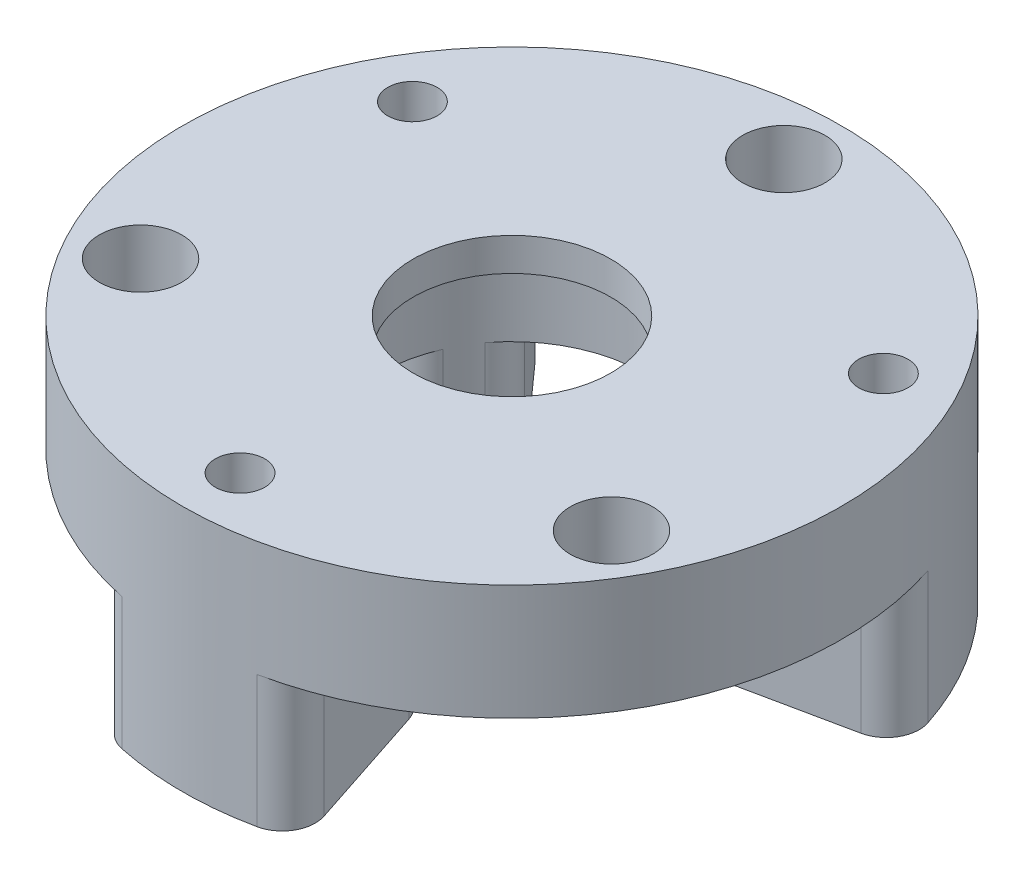
from build123d import *

# Parameters (mm, degrees)
SKETCH1_R           = 20
SKETCH1_R_2         = 8
BOSS_EXTRUDE1_DEPTH = 8
SKETCH2_R           = 20
SKETCH2_R_2         = 8
BOSS_EXTRUDE2_DEPTH = 7
BOSS_EXTRUDE3_START = -2
SKETCH3_R           = 8
SKETCH3_R_2         = 6
BOSS_EXTRUDE3_DEPTH = 2
SKETCH4_R           = 2.5
SKETCH4_R_2         = 1.5
CUT_EXTRUDE1_DEPTH  = 33.015621187
SKETCH5_R           = 2.5
CUT_EXTRUDE2_DEPTH  = 8
CIRPATTERN1_COUNT   = 3
FILLET1_R           = 2


with BuildPart() as part:
    # Sketch1 → Boss-Extrude1 (new body)
    with BuildSketch(Plane(origin=(0, 0, 0), x_dir=(1, 0, 0), z_dir=(0, 1, 0))):
        Circle(SKETCH1_R)
        Circle(SKETCH1_R_2, mode=Mode.SUBTRACT)
    extrude(amount=BOSS_EXTRUDE1_DEPTH)

    # Sketch2 → Boss-Extrude2 (add)
    with BuildSketch(Plane(origin=(0, 8, 0), x_dir=(1, 0, 0), z_dir=(0, 1, 0))):
        Circle(SKETCH2_R)
        Circle(SKETCH2_R_2, mode=Mode.SUBTRACT)
    extrude(amount=BOSS_EXTRUDE2_DEPTH)

    # Sketch3 → Boss-Extrude3 (add)
    with BuildSketch(Plane(origin=(0, 15, 0), x_dir=(1, 0, 0), z_dir=(0, 1, 0)).offset(BOSS_EXTRUDE3_START)):
        Circle(SKETCH3_R)
        Circle(SKETCH3_R_2, mode=Mode.SUBTRACT)
    extrude(amount=BOSS_EXTRUDE3_DEPTH)

    # Sketch4 → Cut-Extrude1 (cut, through all)
    with BuildSketch(Plane(origin=(0, 15, 0), x_dir=(1, 0, 0), z_dir=(0, 1, 0))):
        with Locations((0, 16.5)):
            Circle(SKETCH4_R)
        with Locations((14.289419162, -8.25)):
            Circle(SKETCH4_R)
        with Locations((-14.289419162, -8.25)):
            Circle(SKETCH4_R)
        with Locations((0, -16.5)):
            Circle(SKETCH4_R_2)
        with Locations((-14.289419162, 8.25)):
            Circle(SKETCH4_R_2)
        with Locations((14.289419162, 8.25)):
            Circle(SKETCH4_R_2)
    extrude(amount=-CUT_EXTRUDE1_DEPTH, mode=Mode.SUBTRACT)

    # Sketch5 → Cut-Extrude2 (cut)
    with BuildSketch(Plane.XZ):
        with BuildLine():
            ThreePointArc((-3.332922817, 7.272662889), (-2.919714264, 7.448172166), (-2.497311128, 7.600226124))
            Line((-2.497311128, 7.600226124), (-6.243277821, 19.000565309))
            ThreePointArc((-6.243277821, 19.000565309), (-7.62611844, 18.488978272), (-8.967511687, 17.876905049))
            ThreePointArc((-8.967511687, 17.876905049), (-17.320508076, 10), (-19.965609757, -1.172359595))
            ThreePointArc((-19.965609757, -1.172359595), (-19.824984093, -2.640076835), (-19.576611154, -4.093445459))
            Line((-19.576611154, -4.093445459), (-7.830644462, -1.637378184))
            ThreePointArc((-7.830644462, -1.637378184), (-7.91016344, -1.195539359), (-7.964772223, -0.749935616))
            ThreePointArc((-7.964772223, -0.749935616), (-6.92820323, 4), (-3.332922817, 7.272662889))
        make_face()
        with Locations((-14.289419162, 8.25)):
            Circle(SKETCH5_R, mode=Mode.SUBTRACT)
    cut_extrude2 = extrude(amount=-CUT_EXTRUDE2_DEPTH, mode=Mode.SUBTRACT)

    # CirPattern1: Cut-Extrude2 ×3 about axis
    cirpattern1_axis = Axis((0, 8, 0), (0, -1, 0))
    for i in range(1, CIRPATTERN1_COUNT):
        add(cut_extrude2.rotate(cirpattern1_axis, i * 360 / CIRPATTERN1_COUNT), mode=Mode.SUBTRACT)

    # Fillet1
    fillet1_edges = [part.edges().sort_by_distance(p)[0] for p in [
        (-6.243277821, 4, 19.000565309),
        (-7.830644462, 4, -1.637378184),
        (-19.576611154, 4, -4.093445459),
        (-13.333333333, 4, -14.90711985),
        (-5.333333333, 4, -5.96284794),
        (5.333333333, 4, -5.96284794),
        (13.333333333, 4, -14.90711985),
        (19.576611154, 4, -4.093445459),
        (7.830644462, 4, -1.637378184),
        (2.497311128, 4, 7.600226124),
        (6.243277821, 4, 19.000565309),
        (-2.497311128, 4, 7.600226124),
    ]]
    fillet(fillet1_edges, radius=FILLET1_R)


solid = part.part
